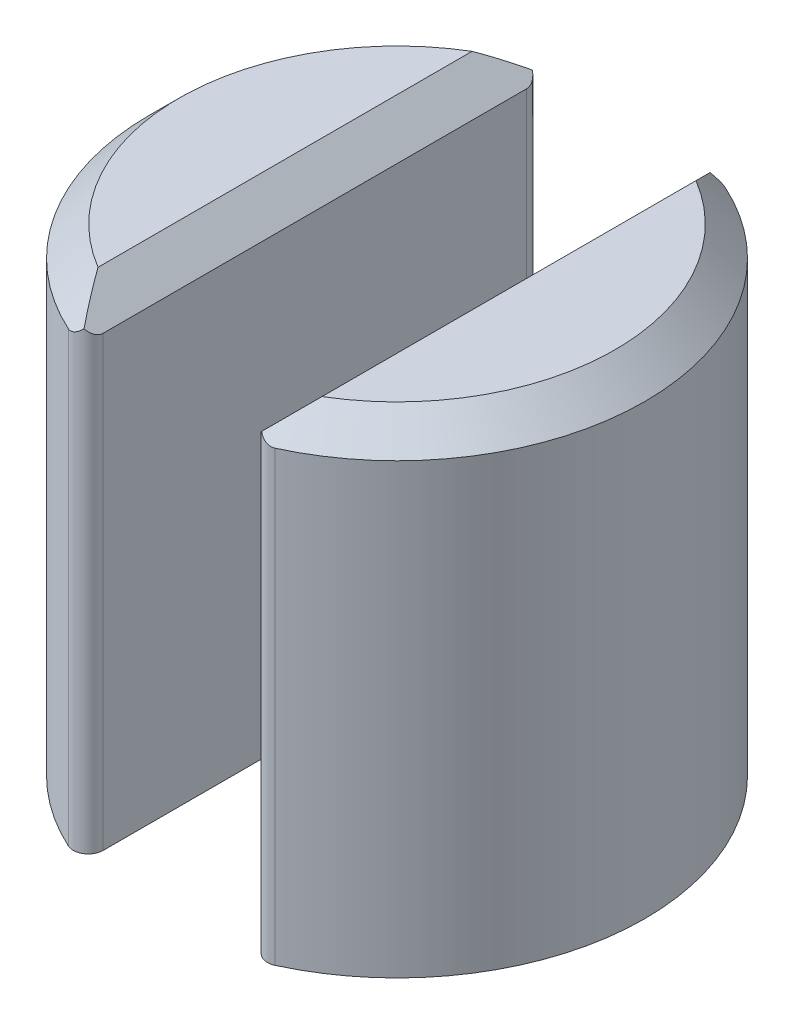
from build123d import *

# Parameters (mm, degrees)
SKETCH1_W           = 2.75
SKETCH1_H           = 1.75
BOSS_EXTRUDE1_DEPTH = 3.75
BOSS_EXTRUDE2_DEPTH = 4.25
FILLET1_R           = 0.25
CHAMFER1_SIZE       = 0.5


with BuildPart() as part:
    # Sketch1 → Boss-Extrude1 (new body)
    with BuildSketch(Plane(origin=(0, 0, 0), x_dir=(1, 0, 0), z_dir=(0, 1, 0))):
        with BuildLine():
            Line((-1.375, 0.875), (-1.375, 3.915593825))
            ThreePointArc((-1.375, 3.915593825), (-4.15, 0), (-1.375, -3.915593825))
            Line((-1.375, -3.915593825), (-1.375, -0.875))
            Line((-1.375, -0.875), (-1.375, 0.875))
        make_face()
        with BuildLine():
            ThreePointArc((4.15, 0), (3.385908298, 2.399609343), (1.375, 3.915593825))
            Line((1.375, 3.915593825), (1.375, 0.875))
            Line((1.375, 0.875), (1.375, -0.875))
            Line((1.375, -0.875), (1.375, -3.915593825))
            ThreePointArc((1.375, -3.915593825), (3.385908298, -2.399609343), (4.15, 0))
        make_face()
        Rectangle(SKETCH1_W, SKETCH1_H)
    extrude(amount=BOSS_EXTRUDE1_DEPTH)

    # Sketch2 → Boss-Extrude2 (add)
    with BuildSketch(Plane(origin=(0, 3.75, 0), x_dir=(1, 0, 0), z_dir=(0, 1, 0))):
        with BuildLine():
            Line((1.375, -0.875), (1.375, 0.875))
            Line((1.375, 0.875), (1.375, 3.915593825))
            ThreePointArc((1.375, 3.915593825), (4.15, 0), (1.375, -3.915593825))
            Line((1.375, -3.915593825), (1.375, -0.875))
        make_face()
        with BuildLine():
            Line((-1.375, 0.875), (-1.375, -0.875))
            Line((-1.375, -0.875), (-1.375, -3.915593825))
            ThreePointArc((-1.375, -3.915593825), (-4.15, 0), (-1.375, 3.915593825))
            Line((-1.375, 3.915593825), (-1.375, 0.875))
        make_face()
    extrude(amount=BOSS_EXTRUDE2_DEPTH)

    # Fillet1
    fillet1_edges = [part.edges().sort_by_distance(p)[0] for p in [
        (1.375, 4, -3.915593825),
        (1.375, 4, 3.915593825),
        (-1.375, 4, 3.915593825),
        (-1.375, 4, -3.915593825),
    ]]
    fillet(fillet1_edges, radius=FILLET1_R)

    # Chamfer1
    # the kernel refuses this chamfer: 0.5 mm, written as the material it takes off along each edge
    with BuildSketch(Plane(origin=(0, 8, 0), x_dir=(0.11938589143460555, 0, -0.99284792839909), z_dir=(-0.99284792839909, 0, -0.11938589143460555))) as chamfer1_piece_1:
        Polygon((4.15, CHAMFER1_SIZE), (4.15 - CHAMFER1_SIZE, 0), (4.15, 0), align=None)
    revolve(axis=Axis((0, 8, 0), (0, -1, 0)), revolution_arc=166.286676069, mode=Mode.SUBTRACT)
    with BuildSketch(Plane(origin=(1.375, 8, 4.831172931), x_dir=(-0.02749587661058651, -0.9996219169112968, 0), z_dir=(0, 0, -1)), Plane(origin=(-1.375, 8, -4.831172931), x_dir=(0.02749587661058651, -0.9996219169112968, 0), z_dir=(0, 0, 1))) as chamfer1_piece_2:
        Polygon((CHAMFER1_SIZE * 0.999621916911, -CHAMFER1_SIZE * 0.0274958766106), (-CHAMFER1_SIZE * 0.0274958766106, -CHAMFER1_SIZE * 0.999621916911), (0, 0), align=None)
    extrude(amount=9.662345862, mode=Mode.SUBTRACT)
    with BuildSketch(Plane(origin=(0, 8, 0), x_dir=(-0.11938589143460458, 0, 0.9928479283990902), z_dir=(0.9928479283990902, 0, 0.11938589143460458))) as chamfer1_piece_3:
        Polygon((4.15 - CHAMFER1_SIZE, 0), (4.15, CHAMFER1_SIZE), (4.15, 0), align=None)
    revolve(axis=Axis((0, 8, 0), (0, -1, 0)), revolution_arc=166.286676069, mode=Mode.SUBTRACT)
    with BuildSketch(Plane(origin=(-1.375, 3.75, 0.875), x_dir=(0, -0.9996219169112968, 0.02749587661058627), z_dir=(1, 0, 0))) as chamfer1_piece_4:
        Polygon((CHAMFER1_SIZE * 0.999621916911, CHAMFER1_SIZE * 0.0274958766106), (-CHAMFER1_SIZE * 0.0274958766106, CHAMFER1_SIZE * 0.999621916911), (0, 0), align=None)
    extrude(amount=2.75, mode=Mode.SUBTRACT)
    with BuildSketch(Plane(origin=(1.375, 3.75, -0.875), x_dir=(0, 0.027495876610586487, 0.9996219169112968), z_dir=(-1, 0, 0))) as chamfer1_piece_5:
        Polygon((CHAMFER1_SIZE * 0.999621916911, -CHAMFER1_SIZE * 0.0274958766106), (-CHAMFER1_SIZE * 0.0274958766106, -CHAMFER1_SIZE * 0.999621916911), (0, 0), align=None)
    extrude(amount=2.75, mode=Mode.SUBTRACT)


solid = part.part
